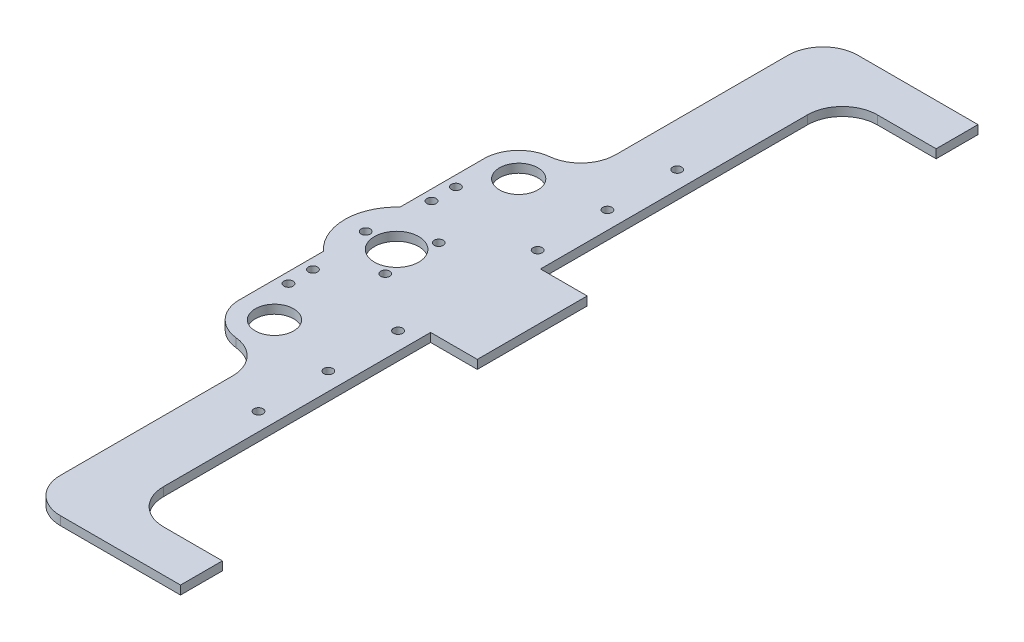
from build123d import *

# Parameters (mm, degrees)
SKETCH1_R           = 6.985
SKETCH1_R_2         = 1.6499967
SKETCH1_R_3         = 8.0645
BOSS_EXTRUDE1_DEPTH = 3.175


with BuildPart() as part:
    # Sketch1 → Boss-Extrude1 (new body)
    with BuildSketch(Plane(origin=(0, 0, 0), x_dir=(1, 0, 0), z_dir=(0, 1, 0))):
        with BuildLine():
            ThreePointArc((-67.971311517, -24.866245744), (-74.128017531, -38.797272158), (-67.971311517, -52.728298572))
            Line((-67.971311517, -52.728298572), (-67.971311517, -82.586411585))
            ThreePointArc((-67.971311517, -82.586411585), (-64.941959488, -91.499608698), (-56.608448003, -95.878494725))
            ThreePointArc((-56.608448003, -95.878494725), (-48.492989851, -100.008926653), (-45.228378476, -108.509717293))
            Line((-45.228378476, -108.509717293), (-45.228378476, -171.249717293))
            ThreePointArc((-45.228378476, -171.249717293), (-41.508634597, -180.229973414), (-32.528378476, -183.949717293))
            Line((-32.528378476, -183.949717293), (7.398418219, -183.949717293))
            Line((7.398418219, -183.949717293), (11.211482469, -183.949717293))
            Line((11.211482469, -183.949717293), (11.211482469, -168.709717293))
            Line((11.211482469, -168.709717293), (-10.203517531, -168.709717293))
            ThreePointArc((-10.203517531, -168.709717293), (-19.183773652, -164.989973414), (-22.903517531, -156.009717293))
            Line((-22.903517531, -156.009717293), (-22.903517531, -58.797272158))
            Line((-22.903517531, -58.797272158), (-5.903517531, -58.797272158))
            Line((-5.903517531, -58.797272158), (-5.903517531, -38.797272158))
            Line((-5.903517531, -38.797272158), (-5.903517531, -18.797272158))
            Line((-5.903517531, -18.797272158), (-22.903517531, -18.797272158))
            Line((-22.903517531, -18.797272158), (-22.903517531, 78.415172977))
            ThreePointArc((-22.903517531, 78.415172977), (-19.183773652, 87.395429098), (-10.203517531, 91.115172977))
            Line((-10.203517531, 91.115172977), (11.211482469, 91.115172977))
            Line((11.211482469, 91.115172977), (11.211482469, 106.355172977))
            Line((11.211482469, 106.355172977), (-32.528378476, 106.355172977))
            ThreePointArc((-32.528378476, 106.355172977), (-41.508634597, 102.635429098), (-45.228378476, 93.655172977))
            Line((-45.228378476, 93.655172977), (-45.228378476, 30.915172977))
            ThreePointArc((-45.228378476, 30.915172977), (-48.492989851, 22.414382337), (-56.608448003, 18.28395041))
            ThreePointArc((-56.608448003, 18.28395041), (-64.941959488, 13.905064383), (-67.971311517, 4.991867269))
            Line((-67.971311517, 4.991867269), (-67.971311517, -24.866245744))
        make_face()
        with Locations((-55.288517531, -83.247272158)):
            Circle(SKETCH1_R, mode=Mode.SUBTRACT)
        with Locations((-64.161311517, -69.277272158)):
            Circle(SKETCH1_R_2, mode=Mode.SUBTRACT)
        with Locations((-64.161311517, -60.387272158)):
            Circle(SKETCH1_R_2, mode=Mode.SUBTRACT)
        with Locations((-49.668767531, -48.530964684)):
            Circle(SKETCH1_R_2, mode=Mode.SUBTRACT)
        with Locations((-29.342032123, -114.997272158)):
            Circle(SKETCH1_R_2, mode=Mode.SUBTRACT)
        with Locations((-29.342032123, -89.597272158)):
            Circle(SKETCH1_R_2, mode=Mode.SUBTRACT)
        with Locations((-29.342032123, -64.197272158)):
            Circle(SKETCH1_R_2, mode=Mode.SUBTRACT)
        with Locations((-66.528017531, -38.797272158)):
            Circle(SKETCH1_R_2, mode=Mode.SUBTRACT)
        with Locations((-64.161311517, -17.207272158)):
            Circle(SKETCH1_R_2, mode=Mode.SUBTRACT)
        with Locations((-64.161311517, -8.317272158)):
            Circle(SKETCH1_R_2, mode=Mode.SUBTRACT)
        with Locations((-55.288517531, -38.797272158)):
            Circle(SKETCH1_R_3, mode=Mode.SUBTRACT)
        with Locations((-55.288517531, 5.652727842)):
            Circle(SKETCH1_R, mode=Mode.SUBTRACT)
        with Locations((-49.668767531, -29.063579632)):
            Circle(SKETCH1_R_2, mode=Mode.SUBTRACT)
        with Locations((-29.342032123, -13.397272158)):
            Circle(SKETCH1_R_2, mode=Mode.SUBTRACT)
        with Locations((-29.342032123, 12.002727842)):
            Circle(SKETCH1_R_2, mode=Mode.SUBTRACT)
        with Locations((-29.342032123, 37.402727842)):
            Circle(SKETCH1_R_2, mode=Mode.SUBTRACT)
    extrude(amount=BOSS_EXTRUDE1_DEPTH)


solid = part.part
